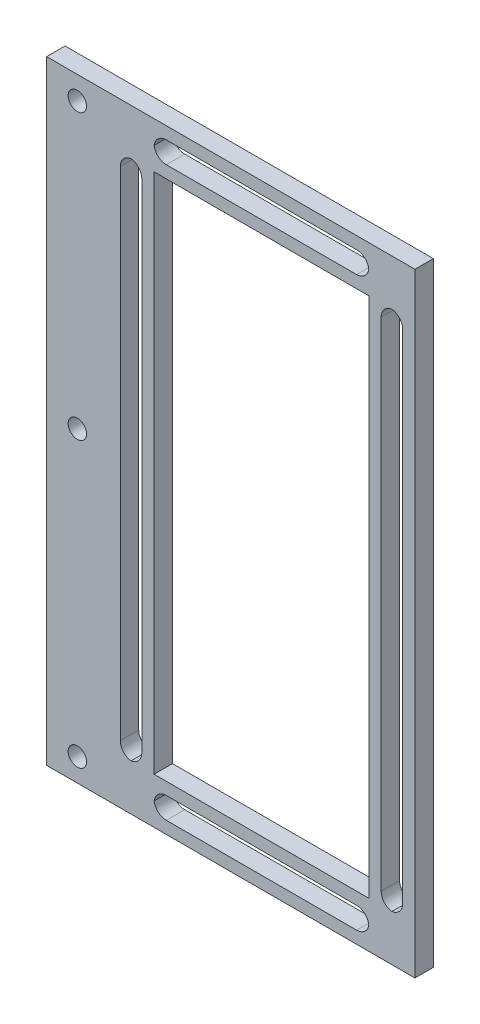
from build123d import *

# Parameters (mm, degrees)
SKETCH2_W           = 60
SKETCH2_H           = 100
SKETCH2_R           = 1.5
SKETCH2_W_2         = 3.5
SKETCH2_H_2         = 85
SKETCH2_W_3         = 35
SKETCH2_H_3         = 3.5
BOSS_EXTRUDE1_DEPTH = 3
FILLET1_R           = 2


with BuildPart() as part:
    # Sketch2 → Boss-Extrude1 (new body)
    with BuildSketch(Plane.XY):
        with Locations((0.630630631, -28.711797537)):
            Rectangle(SKETCH2_W, SKETCH2_H)
        with Locations((-24.369369369, -74.961797537)):
            Circle(SKETCH2_R, mode=Mode.SUBTRACT)
        with Locations((-24.369369369, -28.711797537)):
            Circle(SKETCH2_R, mode=Mode.SUBTRACT)
        with Locations((-15.619369369, -28.711797537)):
            Rectangle(SKETCH2_W_2, SKETCH2_H_2, mode=Mode.SUBTRACT)
        with Locations((5.630630631, -74.961797537)):
            Rectangle(SKETCH2_W_3, SKETCH2_H_3, mode=Mode.SUBTRACT)
        with Locations((26.880630631, -28.711797537)):
            Rectangle(SKETCH2_W_2, SKETCH2_H_2, mode=Mode.SUBTRACT)
        with Locations((-24.369369369, 17.538202463)):
            Circle(SKETCH2_R, mode=Mode.SUBTRACT)
        with Locations((5.630630631, -28.711797537)):
            Rectangle(SKETCH2_W_3, SKETCH2_H_2, mode=Mode.SUBTRACT)
        with Locations((5.630630631, 17.538202463)):
            Rectangle(SKETCH2_W_3, SKETCH2_H_3, mode=Mode.SUBTRACT)
    extrude(amount=BOSS_EXTRUDE1_DEPTH)

    # Fillet1
    # the kernel refuses this fillet: 2 mm, written as the material it adds along each edge
    with BuildSketch(Plane(origin=(-11.869369369, 15.788202463, 0), x_dir=(1, 0, 0), z_dir=(0, 0, 1)), Plane(origin=(23.130630631, 19.288202463, 0), x_dir=(-1, 0, 0), z_dir=(0, 0, 1)), Plane(origin=(-11.869369369, 19.288202463, 0), x_dir=(0, -1, 0), z_dir=(0, 0, 1)), Plane(origin=(-17.369369369, 13.788202463, 0), x_dir=(0, -1, 0), z_dir=(0, 0, 1)), Plane(origin=(25.130630631, 13.788202463, 0), x_dir=(0, -1, 0), z_dir=(0, 0, 1)), Plane(origin=(28.630630631, 13.788202463, 0), x_dir=(-1, 0, 0), z_dir=(0, 0, 1)), Plane(origin=(-13.869369369, 13.788202463, 0), x_dir=(-1, 0, 0), z_dir=(0, 0, 1)), Plane(origin=(-13.869369369, -71.211797537, 0), x_dir=(0, 1, 0), z_dir=(0, 0, 1)), Plane(origin=(25.130630631, -71.211797537, 0), x_dir=(1, 0, 0), z_dir=(0, 0, 1)), Plane(origin=(-11.869369369, -76.711797537, 0), x_dir=(1, 0, 0), z_dir=(0, 0, 1)), Plane(origin=(23.130630631, -73.211797537, 0), x_dir=(-1, 0, 0), z_dir=(0, 0, 1)), Plane(origin=(23.130630631, -76.711797537, 0), x_dir=(0, 1, 0), z_dir=(0, 0, 1))) as fillet1_piece_1:
        with BuildLine():
            CenterArc((FILLET1_R, FILLET1_R), FILLET1_R, 180, 90)
            Line((0, FILLET1_R), (0, 0))
            Line((0, 0), (FILLET1_R, 0))
        make_face()
    extrude(amount=3)
    with BuildSketch(Plane(origin=(23.130630631, 15.788202463, 0), x_dir=(-1, 0, 0), z_dir=(0, 0, 1)), Plane(origin=(28.630630631, -71.211797537, 0), x_dir=(-1, 0, 0), z_dir=(0, 0, 1)), Plane(origin=(-17.369369369, -71.211797537, 0), x_dir=(0, 1, 0), z_dir=(0, 0, 1)), Plane(origin=(-11.869369369, -73.211797537, 0), x_dir=(1, 0, 0), z_dir=(0, 0, 1))) as fillet1_piece_2:
        with BuildLine():
            CenterArc((FILLET1_R, -FILLET1_R), FILLET1_R, 90, 90)
            Line((0, -FILLET1_R), (0, 0))
            Line((0, 0), (FILLET1_R, 0))
        make_face()
    extrude(amount=3)


solid = part.part
